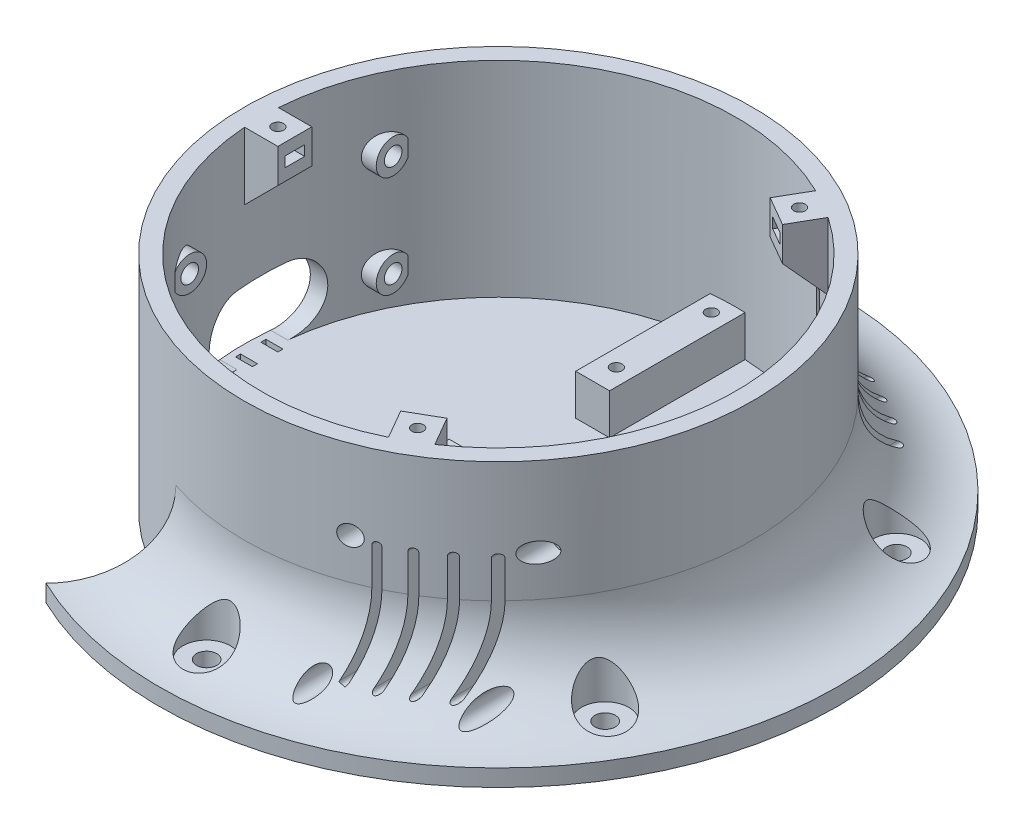
from build123d import *

# Parameters (mm, degrees)
CORTAR_EXTRUIR1_DEPTH       = 109
SALIENTE_EXTRUIR1_DEPTH     = 5
CROQUIS4_R                  = 1.7
CORTAR_EXTRUIR2_DEPTH       = 22
CORTAR_EXTRUIR3_DEPTH       = 1.5
MATRIZC1_COUNT              = 3
CROQUIS6_R                  = 3
CORTAR_EXTRUIR4_DEPTH       = 30.35
CROQUIS7_R                  = 7
CORTAR_EXTRUIR5_DEPTH       = 15
MATRIZC2_COUNT              = 6
CROQUIS8_R                  = 1.7
CORTAR_EXTRUIR6_DEPTH       = 15
CROQUIS9_R                  = 2.95
CORTAR_EXTRUIR7_DEPTH       = 2.5
SALIENTE_EXTRUIR2_DEPTH     = 12
CROQUIS11_R                 = 1.7
CORTAR_EXTRUIR8_DEPTH       = 21
CORTAR_EXTRUIR9_DEPTH       = 3
MATRIZL1_COUNT              = 2
MATRIZL1_PITCH              = 28
CROQUIS13_W                 = 42
CROQUIS13_H                 = 10
CORTAR_EXTRUIR10_DEPTH      = 42
SALIENTE_EXTRUIR3_DEPTH     = 42
CORTAR_EXTRUIR11_DEPTH      = 129
CORTAR_EXTRUIR11_DEPTH_BACK = 42
CROQUIS16_R                 = 1.7
CORTAR_EXTRUIR12_DEPTH      = 67
CROQUIS17_R                 = 2.95
CORTAR_EXTRUIR13_DEPTH      = 37
CROQUIS18_R                 = 2.95
CORTAR_EXTRUIR14_DEPTH      = 61
CORTAR_EXTRUIR15_DEPTH      = 105
CROQUIS22_R                 = 2.6
CORTAR_EXTRUIR16_DEPTH      = 14
SALIENTE_EXTRUIR4_REACH     = 202.527
CROQUIS23_R                 = 5
CROQUIS23_R_2               = 2.6
CROQUIS21_W                 = 5
CROQUIS21_H                 = 1.5
CORTAR_EXTRUIR17_DEPTH      = 18


with BuildPart() as part:
    # Croquis1 → Revolución1 (revolve)
    with BuildSketch(Plane.XY):
        with BuildLine():
            Line((0, 5), (0, 0))
            Line((0, 0), (100, 0))
            Line((100, 0), (100, 5))
            ThreePointArc((100, 5), (82.32233047, 12.32233047), (75, 30))
            Line((75, 30), (75, 65.5))
            Line((75, 65.5), (70, 65.5))
            Line((70, 65.5), (70, 5))
            Line((70, 5), (0, 5))
        make_face()
    revolve(axis=Axis((0, 78.038709788, 0), (0, -1, 0)))

    # Croquis2 → Cortar-Extruir1 (cut)
    with BuildSketch(Plane(origin=(0, 65.5, 0), x_dir=(1, 0, 0), z_dir=(0, 1, 0))):
        with BuildLine():
            Line((-112.943684306, 100), (-112.943684306, -100))
            Line((-112.943684306, -100), (-52.943684306, -100))
            Line((-52.943684306, -100), (-24, -71.056315694))
            ThreePointArc((-24, -71.056315694), (-75, 0), (-24, 71.056315694))
            Line((-24, 71.056315694), (-52.943684306, 100))
            Line((-52.943684306, 100), (-112.943684306, 100))
        make_face()
    extrude(amount=-CORTAR_EXTRUIR1_DEPTH, mode=Mode.SUBTRACT)

    # Croquis3 → Saliente-Extruir1 (add, symmetric)
    with BuildSketch(Plane.XY):
        Polygon((-72, 65.5), (-72, 43.5), (-60, 55.5), (-60, 65.5), (-70, 65.5), align=None)
    saliente_extruir1 = extrude(amount=SALIENTE_EXTRUIR1_DEPTH, both=True)

    # Croquis4 → Cortar-Extruir2 (cut)
    with BuildSketch(Plane(origin=(0, 65.5, 0), x_dir=(1, 0, 0), z_dir=(0, 1, 0))):
        with Locations((-65, 0)):
            Circle(CROQUIS4_R)
    cortar_extruir2 = extrude(amount=-CORTAR_EXTRUIR2_DEPTH, mode=Mode.SUBTRACT)

    # Croquis5 → Cortar-Extruir3 (cut, symmetric)
    with BuildSketch(Plane(origin=(0, 60.5, 0), x_dir=(1, 0, 0), z_dir=(0, 1, 0))):
        Polygon((-63.325, 2.901185103), (-56.675, 2.901185103), (-56.675, -2.901185103), (-63.325, -2.901185103), (-66.675, -2.901185103), (-68.35, 0), (-66.675, 2.901185103), align=None)
    cortar_extruir3 = extrude(amount=CORTAR_EXTRUIR3_DEPTH, both=True, mode=Mode.SUBTRACT)

    # MatrizC1: Saliente-Extruir1, Cortar-Extruir2, Cortar-Extruir3 ×3 about axis
    matrizc1_axis = Axis((0, 65.5, 0), (0, 1, 0))
    add([saliente_extruir1.rotate(matrizc1_axis, i * 360 / MATRIZC1_COUNT) for i in range(1, MATRIZC1_COUNT)])
    add([cortar_extruir2.rotate(matrizc1_axis, i * 360 / MATRIZC1_COUNT) for i in range(1, MATRIZC1_COUNT)], mode=Mode.SUBTRACT)
    add([cortar_extruir3.rotate(matrizc1_axis, i * 360 / MATRIZC1_COUNT) for i in range(1, MATRIZC1_COUNT)], mode=Mode.SUBTRACT)

    # Croquis6 → Cortar-Extruir4 (cut)
    with BuildSketch(Plane.XZ):
        with Locations((0, -86)):
            Circle(CROQUIS6_R)
    cortar_extruir4 = extrude(amount=-CORTAR_EXTRUIR4_DEPTH, mode=Mode.SUBTRACT)

    # Croquis7 → Cortar-Extruir5 (cut)
    with BuildSketch(Plane(origin=(0, 20, 0), x_dir=(-1, 0, 0), z_dir=(0, -1, 0))):
        with Locations((0, 86)):
            Circle(CROQUIS7_R)
    cortar_extruir5 = extrude(amount=CORTAR_EXTRUIR5_DEPTH, mode=Mode.SUBTRACT)

    # MatrizC2: Cortar-Extruir4, Cortar-Extruir5 ×6 about axis
    matrizc2_axis = Axis((0, 65.5, 0), (0, 1, 0))
    add([cortar_extruir4.rotate(matrizc2_axis, i * 360 / MATRIZC2_COUNT) for i in range(1, MATRIZC2_COUNT)], mode=Mode.SUBTRACT)
    add([cortar_extruir5.rotate(matrizc2_axis, i * 360 / MATRIZC2_COUNT) for i in range(1, MATRIZC2_COUNT)], mode=Mode.SUBTRACT)

    # Croquis8 → Cortar-Extruir6 (cut)
    with BuildSketch(Plane.XZ):
        with Locations((24.5, 15.5)):
            Circle(CROQUIS8_R)
        with Locations((55.5, 15.5)):
            Circle(CROQUIS8_R)
        with Locations((24.5, -15.5)):
            Circle(CROQUIS8_R)
        with Locations((55.5, -15.5)):
            Circle(CROQUIS8_R)
    extrude(amount=-CORTAR_EXTRUIR6_DEPTH, mode=Mode.SUBTRACT)

    # Croquis9 → Cortar-Extruir7 (cut)
    with BuildSketch(Plane.XZ):
        with Locations((24.5, 15.5)):
            Circle(CROQUIS9_R)
        with Locations((24.5, -15.5)):
            Circle(CROQUIS9_R)
        with Locations((55.5, -15.5)):
            Circle(CROQUIS9_R)
        with Locations((55.5, 15.5)):
            Circle(CROQUIS9_R)
    extrude(amount=-CORTAR_EXTRUIR7_DEPTH, mode=Mode.SUBTRACT)

    # Croquis10 → Saliente-Extruir2 (add)
    with BuildSketch(Plane(origin=(0, 5, 0), x_dir=(1, 0, 0), z_dir=(0, 1, 0))):
        with BuildLine():
            Line((2.8, 30), (-7.2, 30))
            Line((-7.2, 30), (-7.2, 69.628729703))
            ThreePointArc((-7.2, 69.628729703), (-2.205639433, 69.965242476), (2.8, 69.943977582))
            Line((2.8, 69.943977582), (2.8, 30))
        make_face()
    extrude(amount=SALIENTE_EXTRUIR2_DEPTH)

    # Croquis11 → Cortar-Extruir8 (cut)
    with BuildSketch(Plane(origin=(0, 17, 0), x_dir=(1, 0, 0), z_dir=(0, 1, 0))):
        with Locations((-2.2, 37)):
            Circle(CROQUIS11_R)
    cortar_extruir8 = extrude(amount=-CORTAR_EXTRUIR8_DEPTH, mode=Mode.SUBTRACT)

    # Croquis12 → Cortar-Extruir9 (cut)
    with BuildSketch(Plane(origin=(0, 10.65, 0), x_dir=(1, 0, 0), z_dir=(0, 1, 0))):
        Polygon((-3.875, 39.901185103), (-10.525, 39.901185103), (-10.525, 34.098814897), (-3.875, 34.098814897), (-0.525, 34.098814897), (1.15, 37), (-0.525, 39.901185103), align=None)
    cortar_extruir9 = extrude(amount=-CORTAR_EXTRUIR9_DEPTH, mode=Mode.SUBTRACT)

    # MatrizL1: Cortar-Extruir8, Cortar-Extruir9 ×2
    with Locations(*[(0, 0, -i * MATRIZL1_PITCH) for i in range(1, MATRIZL1_COUNT)]):
        add(cortar_extruir8, mode=Mode.SUBTRACT)
        add(cortar_extruir9, mode=Mode.SUBTRACT)

    # Croquis13 → Cortar-Extruir10 (cut)
    with BuildSketch(Plane(origin=(0, 5, 0), x_dir=(1, 0, 0), z_dir=(0, 1, 0))):
        with Locations((42.5, -31)):
            Rectangle(CROQUIS13_W, CROQUIS13_H)
    extrude(amount=CORTAR_EXTRUIR10_DEPTH, mode=Mode.SUBTRACT)

    # Croquis14 → Saliente-Extruir3 (add)
    with BuildSketch(Plane(origin=(0, 5, 0), x_dir=(1, 0, 0), z_dir=(0, 1, 0))):
        with BuildLine():
            ThreePointArc((21.5, -66.616439413), (43.54609425, -54.806365283), (60.033324079, -36))
            Line((60.033324079, -36), (21.5, -36))
            Line((21.5, -36), (21.5, -66.616439413))
        make_face()
    extrude(amount=SALIENTE_EXTRUIR3_DEPTH)

    # Croquis15 → Cortar-Extruir11 (cut, two sides: drawn at the far end of the back side and taken through both)
    with BuildSketch(Plane(origin=(0, 0, 36), x_dir=(-1, 0, 0), z_dir=(0, 0, -1)).offset(-CORTAR_EXTRUIR11_DEPTH_BACK)):
        with BuildLine():
            Line((-52, 41), (-52, 11))
            ThreePointArc((-52, 11), (-53, 10), (-54, 11))
            Line((-54, 11), (-54, 41))
            ThreePointArc((-54, 41), (-53, 42), (-52, 41))
        make_face()
        with BuildLine():
            Line((-31, 41), (-31, 11))
            ThreePointArc((-31, 11), (-32, 10), (-33, 11))
            Line((-33, 11), (-33, 41))
            ThreePointArc((-33, 41), (-32, 42), (-31, 41))
        make_face()
        with BuildLine():
            Line((-45, 41), (-45, 11))
            ThreePointArc((-45, 11), (-46, 10), (-47, 11))
            Line((-47, 11), (-47, 41))
            ThreePointArc((-47, 41), (-46, 42), (-45, 41))
        make_face()
        with BuildLine():
            Line((-38, 41), (-38, 11))
            ThreePointArc((-38, 11), (-39, 10), (-40, 11))
            Line((-40, 11), (-40, 41))
            ThreePointArc((-40, 41), (-39, 42), (-38, 41))
        make_face()
    extrude(amount=CORTAR_EXTRUIR11_DEPTH + CORTAR_EXTRUIR11_DEPTH_BACK, mode=Mode.SUBTRACT)

    # Croquis16 → Cortar-Extruir12 (cut)
    with BuildSketch(Plane(origin=(0, 0, 36), x_dir=(-1, 0, 0), z_dir=(0, 0, -1))):
        with Locations((-58.5, 42)):
            Circle(CROQUIS16_R)
        with Locations((-26.5, 42)):
            Circle(CROQUIS16_R)
        with Locations((-58.5, 10)):
            Circle(CROQUIS16_R)
        with Locations((-26.5, 10)):
            Circle(CROQUIS16_R)
    extrude(amount=-CORTAR_EXTRUIR12_DEPTH, mode=Mode.SUBTRACT)

    # Croquis17 → Cortar-Extruir13 (cut)
    with BuildSketch(Plane(origin=(0, 0, 101), x_dir=(-1, 0, 0), z_dir=(0, 0, -1))):
        with Locations((-26.5, 42)):
            Circle(CROQUIS17_R)
        with Locations((-26.5, 10)):
            Circle(CROQUIS17_R)
    extrude(amount=CORTAR_EXTRUIR13_DEPTH, mode=Mode.SUBTRACT)

    # Croquis18 → Cortar-Extruir14 (cut)
    with BuildSketch(Plane(origin=(0, 0, 101), x_dir=(-1, 0, 0), z_dir=(0, 0, -1))):
        with Locations((-58.5, 42)):
            Circle(CROQUIS18_R)
        with Locations((-58.5, 10)):
            Circle(CROQUIS18_R)
    extrude(amount=CORTAR_EXTRUIR14_DEPTH, mode=Mode.SUBTRACT)

    # Croquis19 → Cortar-Extruir15 (cut)
    with BuildSketch(Plane(origin=(0, 0, 0), x_dir=(0, 0, -1), z_dir=(1, 0, 0))):
        with BuildLine():
            Line((7.5, 5), (-7.5, 5))
            ThreePointArc((-7.5, 5), (-17.5, 15), (-7.5, 25))
            Line((-7.5, 25), (7.5, 25))
            ThreePointArc((7.5, 25), (17.5, 15), (7.5, 5))
        make_face()
    extrude(amount=-CORTAR_EXTRUIR15_DEPTH, mode=Mode.SUBTRACT)

    # Croquis22 → Cortar-Extruir16 (cut)
    with BuildSketch(Plane.ZY.offset(75)):
        with Locations((-30, 45)):
            Circle(CROQUIS22_R)
        with Locations((-30, 15)):
            Circle(CROQUIS22_R)
        with Locations((30, 15)):
            Circle(CROQUIS22_R)
        with Locations((30, 45)):
            Circle(CROQUIS22_R)
    extrude(amount=-CORTAR_EXTRUIR16_DEPTH, mode=Mode.SUBTRACT)

    # Croquis23 → Saliente-Extruir4 (add, up to next)
    with BuildSketch(Plane(origin=(-61, 0, 0), x_dir=(0, 0, -1), z_dir=(1, 0, 0)), mode=Mode.PRIVATE) as saliente_extruir4_sk1:
        with Locations((-30, 45)):
            Circle(CROQUIS23_R)
        with Locations((-30, 45)):
            Circle(CROQUIS23_R_2, mode=Mode.SUBTRACT)
    saliente_extruir4_tool1 = extrude(saliente_extruir4_sk1.sketch, amount=-SALIENTE_EXTRUIR4_REACH, mode=Mode.PRIVATE) - part.part
    # Croquis23 → Saliente-Extruir4 (add, up to next)
    with BuildSketch(Plane(origin=(-61, 0, 0), x_dir=(0, 0, -1), z_dir=(1, 0, 0)), mode=Mode.PRIVATE) as saliente_extruir4_sk2:
        with Locations((-30, 15)):
            Circle(CROQUIS23_R)
        with Locations((-30, 15)):
            Circle(CROQUIS23_R_2, mode=Mode.SUBTRACT)
    saliente_extruir4_tool2 = extrude(saliente_extruir4_sk2.sketch, amount=-SALIENTE_EXTRUIR4_REACH, mode=Mode.PRIVATE) - part.part
    # Croquis23 → Saliente-Extruir4 (add, up to next)
    with BuildSketch(Plane(origin=(-61, 0, 0), x_dir=(0, 0, -1), z_dir=(1, 0, 0)), mode=Mode.PRIVATE) as saliente_extruir4_sk3:
        with Locations((30, 15)):
            Circle(CROQUIS23_R)
        with Locations((30, 15)):
            Circle(CROQUIS23_R_2, mode=Mode.SUBTRACT)
    saliente_extruir4_tool3 = extrude(saliente_extruir4_sk3.sketch, amount=-SALIENTE_EXTRUIR4_REACH, mode=Mode.PRIVATE) - part.part
    # Croquis23 → Saliente-Extruir4 (add, up to next)
    with BuildSketch(Plane(origin=(-61, 0, 0), x_dir=(0, 0, -1), z_dir=(1, 0, 0)), mode=Mode.PRIVATE) as saliente_extruir4_sk4:
        with Locations((30, 45)):
            Circle(CROQUIS23_R)
        with Locations((30, 45)):
            Circle(CROQUIS23_R_2, mode=Mode.SUBTRACT)
    saliente_extruir4_tool4 = extrude(saliente_extruir4_sk4.sketch, amount=-SALIENTE_EXTRUIR4_REACH, mode=Mode.PRIVATE) - part.part
    add(saliente_extruir4_tool1.solids().sort_by_distance((-61, 45, 34.858579))[0])
    add(saliente_extruir4_tool2.solids().sort_by_distance((-61, 15, 34.858579))[0])
    add(saliente_extruir4_tool3.solids().sort_by_distance((-61, 15, -25.141421))[0])
    add(saliente_extruir4_tool4.solids().sort_by_distance((-61, 45, -25.141421))[0])

    # Croquis21 → Cortar-Extruir17 (cut)
    with BuildSketch(Plane(origin=(0, 5, 0), x_dir=(1, 0, 0), z_dir=(0, 1, 0))):
        with Locations((-70.5, 3.75)):
            Rectangle(CROQUIS21_W, CROQUIS21_H)
        with Locations((-70.5, -3.75)):
            Rectangle(CROQUIS21_W, CROQUIS21_H)
    extrude(amount=-CORTAR_EXTRUIR17_DEPTH, mode=Mode.SUBTRACT)


solid = part.part
